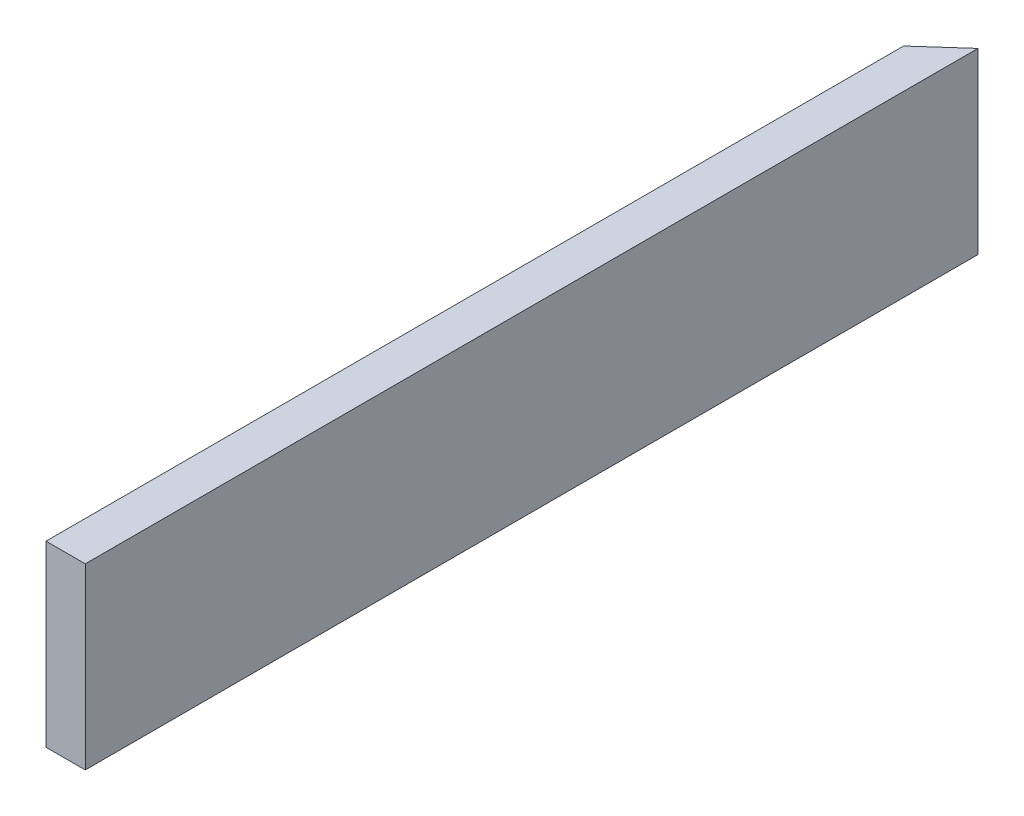
from build123d import *

# Parameters (mm, degrees)
SKETCH1_W           = 2.2
SKETCH1_H           = 10
BOSS_EXTRUDE1_DEPTH = 50
CUT_EXTRUDE1_DEPTH  = 52


with BuildPart() as part:
    # Sketch1 → Boss-Extrude1 (new body)
    with BuildSketch(Plane.XY):
        with Locations((-2.003225806, 7.838709677)):
            Rectangle(SKETCH1_W, SKETCH1_H)
    extrude(amount=BOSS_EXTRUDE1_DEPTH)

    # Sketch3 → Cut-Extrude1 (cut)
    with BuildSketch(Plane(origin=(0, 12.838709677, 0), x_dir=(1, 0, 0), z_dir=(0, 1, 0))):
        Polygon((-0.903225806, 0), (-3.103225806, -1.967027021), (-3.103225806, 0), align=None)
    extrude(amount=-CUT_EXTRUDE1_DEPTH, mode=Mode.SUBTRACT)


solid = part.part
